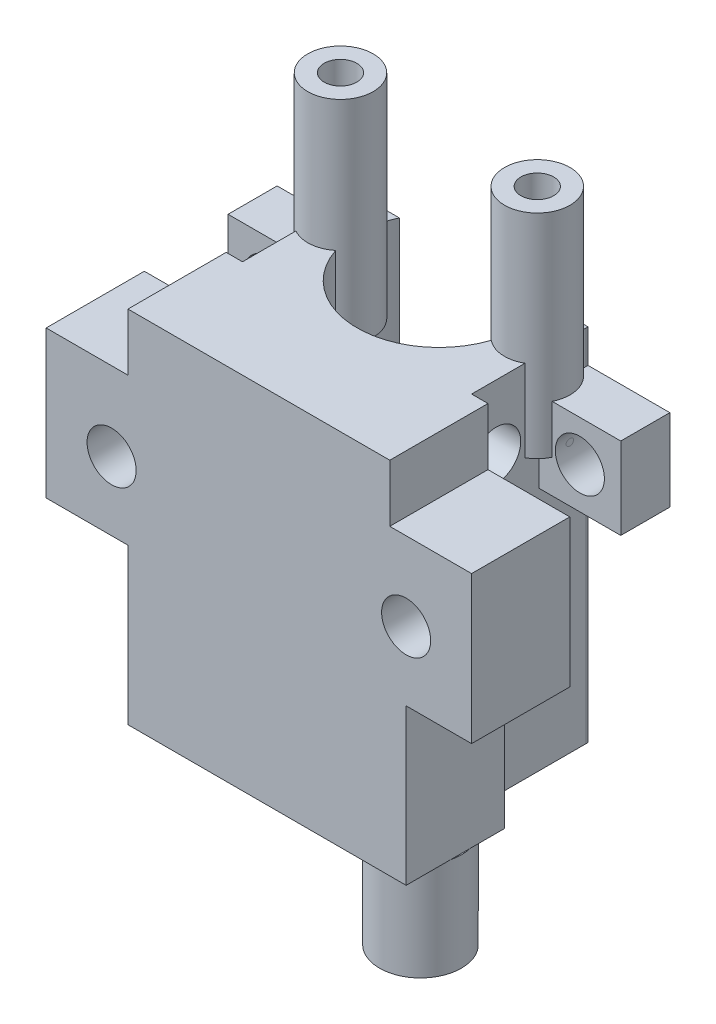
from build123d import *

# Parameters (mm, degrees)
ESBO_O1_R                      = 1.5
RESSALTO_EXTRUS_O1_DEPTH       = 6
ESBO_O6_W                      = 14
ESBO_O6_H                      = 22
RESSALTO_EXTRUS_O3_DEPTH       = 12
ESBO_O7_R                      = 5
CORTE_EXTRUS_O4_DEPTH          = 30.538450843
FILETE3_R                      = 5
ESBO_O11_R                     = 2.5
RESSALTO_EXTRUS_O11_DEPTH      = 6
RESSALTO_EXTRUS_O13_DEPTH      = 8
RESSALTO_EXTRUS_O13_DEPTH_BACK = 5
ESBO_O15_R                     = 2
ESBO_O17_R                     = 1
CORTE_EXTRUS_O6_DEPTH          = 8
ESBO_O20_R                     = 0.75
CORTE_EXTRUS_O7_DEPTH          = 5
ESBO_O21_W                     = 22.669500521
ESBO_O21_H                     = 31.157259519
CORTE_EXTRUS_O8_DEPTH          = 6
ESBO_O22_W                     = 5
ESBO_O22_H                     = 5
ESBO_O22_R                     = 1.5
RESSALTO_EXTRUS_O15_DEPTH      = 3
CHANFRO5_SIZE                  = 1
ESBO_O23_R                     = 1.5
CORTE_EXTRUS_O9_DEPTH          = 17


with BuildPart() as part:
    # Esboço1 → Ressalto-extrusão1 (new body)
    with BuildSketch(Plane.XY):
        Polygon((-10.637137788, -1.832768542), (6.362862212, -1.832768542), (6.362862212, 7.667231458), (10.362862212, 7.667231458), (10.362862212, 16.667231458), (5.362862212, 16.667231458), (5.362862212, 20.167231458), (-10.637137788, 20.167231458), (-10.637137788, 16.667231458), (-15.637137788, 16.667231458), (-15.637137788, 7.667231458), (-10.637137788, 7.667231458), align=None)
        with Locations((6.362862212, 11.867231458)):
            Circle(ESBO_O1_R, mode=Mode.SUBTRACT)
        with Locations((-11.637137788, 11.867231458)):
            Circle(ESBO_O1_R, mode=Mode.SUBTRACT)
    extrude(amount=RESSALTO_EXTRUS_O1_DEPTH)

    # Esboço6 → Ressalto-extrusão3 (add)
    with BuildSketch(Plane(origin=(0, 0, 0), x_dir=(-1, 0, 0), z_dir=(0, 0, -1))):
        with Locations((2.637137788, 9.167231458)):
            Rectangle(ESBO_O6_W, ESBO_O6_H)
    extrude(amount=RESSALTO_EXTRUS_O3_DEPTH)

    # Esboço7 → Corte-extrusão4 (cut, through all)
    with BuildSketch(Plane.XZ.offset(1.832768542)):
        with Locations(Location((-2.637137788, -5, 0), (0, 0, 270))):
            Circle(ESBO_O7_R)
    extrude(amount=-CORTE_EXTRUS_O4_DEPTH, mode=Mode.SUBTRACT)

    # Filete3
    filete3_edges = [part.edges().sort_by_distance(p)[0] for p in [
        (4.362862212, 9.167231458, -12),
        (-9.637137788, 9.167231458, -12),
    ]]
    fillet(filete3_edges, radius=FILETE3_R)

    # Esboço11 → Ressalto-extrusão11 (add)
    with BuildSketch(Plane.XZ.offset(1.832768542)):
        with Locations(Location((3.938862212, 2.7, 0), (0, 0, 14.163833683))):
            Circle(ESBO_O11_R)
    extrude(amount=RESSALTO_EXTRUS_O11_DEPTH)

    # Esboço15 → Ressalto-extrusão13 (add, two sides: drawn at the far end of the back side and taken through both)
    with BuildSketch(Plane(origin=(0, 20.167231458, 0), x_dir=(1, 0, 0), z_dir=(0, 1, 0)).offset(-RESSALTO_EXTRUS_O13_DEPTH_BACK)):
        with Locations(Location((-8.650480796, 5, 0), (0, 0, 270))):
            Circle(ESBO_O15_R)
        with Locations(Location((3.376205221, 5, 0), (0, 0, 270))):
            Circle(ESBO_O15_R)
    extrude(amount=RESSALTO_EXTRUS_O13_DEPTH + RESSALTO_EXTRUS_O13_DEPTH_BACK)

    # Esboço17 → Corte-extrusão6 (cut)
    with BuildSketch(Plane(origin=(0, 28.167231458, 0), x_dir=(1, 0, 0), z_dir=(0, 1, 0))):
        with Locations(Location((-8.650480796, 5, 0), (0, 0, 270))):
            Circle(ESBO_O17_R)
        with Locations(Location((3.376205221, 5, 0), (0, 0, 270))):
            Circle(ESBO_O17_R)
    extrude(amount=-CORTE_EXTRUS_O6_DEPTH, mode=Mode.SUBTRACT)

    # Esboço20 → Corte-extrusão7 (cut)
    with BuildSketch(Plane.XZ.offset(7.832768542)):
        with Locations(Location((3.938862212, 2.7, 0), (0, 0, 270))):
            Circle(ESBO_O20_R)
    extrude(amount=-CORTE_EXTRUS_O7_DEPTH, mode=Mode.SUBTRACT)

    # Esboço21 → Corte-extrusão8 (cut)
    with BuildSketch(Plane(origin=(0, 0, -7.115225733), x_dir=(1, 0, 0), z_dir=(0, 0, -1))):
        with Locations((-2.778124877, -9.864448806)):
            Rectangle(ESBO_O21_W, ESBO_O21_H)
    extrude(amount=CORTE_EXTRUS_O8_DEPTH, mode=Mode.SUBTRACT)

    # Esboço22 → Ressalto-extrusão15 (add)
    # profile 1 of 2: a face of its own
    with BuildSketch(Plane(origin=(0, 0, -7.115225733), x_dir=(1, 0, 0), z_dir=(0, 0, -1))):
        with Locations((-12.135809914, -15.625880271)):
            Rectangle(ESBO_O22_W, ESBO_O22_H)
        with Locations(Location((-12.135809914, -15.625880271, 0), (0, 0, 180))):
            Circle(ESBO_O22_R, mode=Mode.SUBTRACT)
    # profile 2 of 2: a face of its own
    with BuildSketch(Plane(origin=(0, 0, -7.115225733), x_dir=(1, 0, 0), z_dir=(0, 0, -1))):
        with Locations((6.862862212, -15.625880271)):
            Rectangle(ESBO_O22_W, ESBO_O22_H)
        with Locations(Location((6.862862212, -15.625880271, 0), (0, 0, 180))):
            Circle(ESBO_O22_R, mode=Mode.SUBTRACT)
    extrude(amount=-RESSALTO_EXTRUS_O15_DEPTH)

    # Chanfro5
    # the kernel refuses this chamfer: 1 mm, written as the material it takes off along each edge
    with BuildSketch(Plane(origin=(6.362862212, 11.867231458, 0), x_dir=(1, 0, 0), z_dir=(0, -1, 0))) as chanfro5_piece_1_section:
        Polygon((1.5 + CHANFRO5_SIZE, 0), (1.5, CHANFRO5_SIZE), (1.5, 0), align=None)
    chanfro5_piece_1 = revolve(axis=Axis((6.362862212, 11.867231458, 0), (0, 0, 1)), mode=Mode.PRIVATE)
    chanfro5_piece_1 = split(chanfro5_piece_1, bisect_by=Plane(origin=(4.362862212, 13.893105183, 0.134898453), z_dir=(1, 0, 0)), keep=Keep.TOP, mode=Mode.PRIVATE)
    add(chanfro5_piece_1, mode=Mode.SUBTRACT)
    with BuildSketch(Plane(origin=(-11.637137788, 11.867231458, 0), x_dir=(1, 0, 0), z_dir=(0, -1, 0))) as chanfro5_piece_2_section:
        Polygon((1.5 + CHANFRO5_SIZE, 0), (1.5, CHANFRO5_SIZE), (1.5, 0), align=None)
    chanfro5_piece_2 = revolve(axis=Axis((-11.637137788, 11.867231458, 0), (0, 0, 1)), mode=Mode.PRIVATE)
    chanfro5_piece_2 = split(chanfro5_piece_2, bisect_by=Plane(origin=(-9.637137788, 11.867231458, 0.487087965), z_dir=(-1, 0, 0)), keep=Keep.TOP, mode=Mode.PRIVATE)
    add(chanfro5_piece_2, mode=Mode.SUBTRACT)

    # Esboço23 → Corte-extrusão9 (cut)
    with BuildSketch(Plane.ZY.offset(9.637137788)):
        with Locations((-1.5, 16.167231458)):
            Circle(ESBO_O23_R)
    extrude(amount=-CORTE_EXTRUS_O9_DEPTH, mode=Mode.SUBTRACT)


solid = part.part
